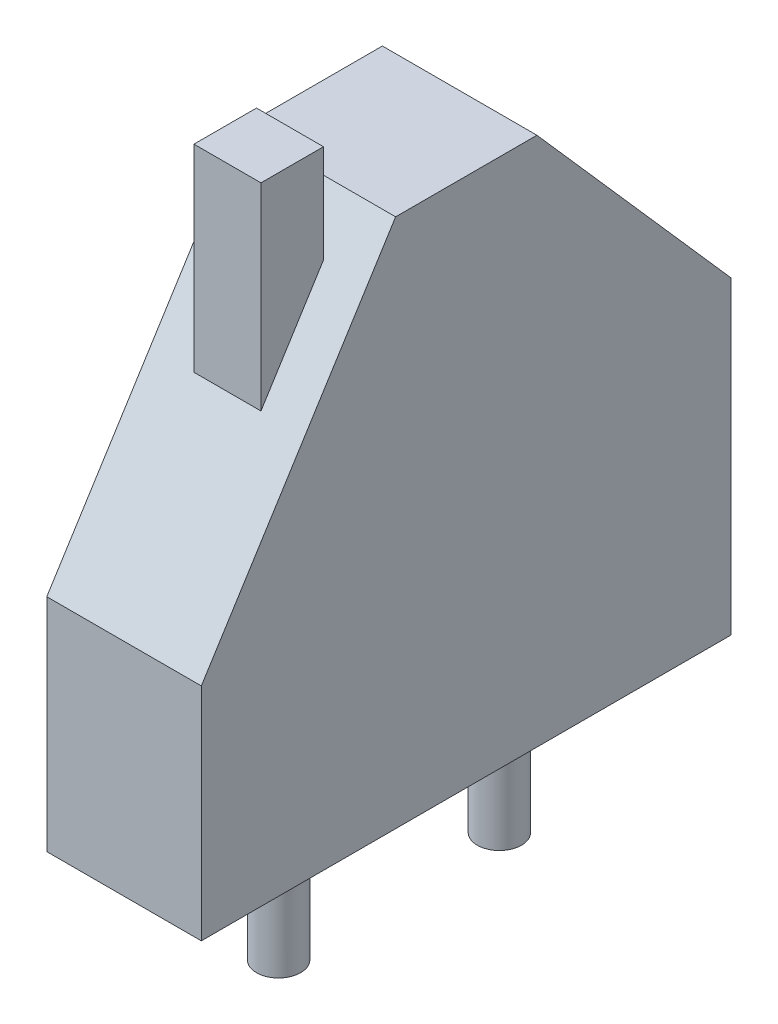
from build123d import *

# Parameters (mm, degrees)
SKETCH_1_W          = 3.5
SKETCH_1_H          = 12
EXTRUDE_1_DEPTH     = 12
SKETCH_2_R          = 0.5
EXTRUDE_2_DEPTH     = 3
CUT_EXTRUDE_1_DEPTH = 5
SKETCH_4_W          = 1.517225246
SKETCH_4_H          = 1.416076897
EXTRUDE_1_2_DEPTH   = 13.2
SKETCH_5_W          = 1.517190274
SKETCH_5_H          = 1.226412018
CUT_EXTRUDE_2_DEPTH = 2
CHAMFER_1_SIZE      = 0.5


with BuildPart() as part:
    # 草图1 → Extrude 1 (new body)
    with BuildSketch(Plane(origin=(0, 0, 0), x_dir=(1, 0, 0), z_dir=(0, 1, 0))):
        Rectangle(SKETCH_1_W, SKETCH_1_H)
    extrude(amount=EXTRUDE_1_DEPTH)

    # 草图2 → 拉伸2 (add)
    with BuildSketch(Plane.XZ):
        with Locations((0, 2.5)):
            Circle(SKETCH_2_R)
        with Locations((0, -2.5)):
            Circle(SKETCH_2_R)
    extrude(amount=EXTRUDE_2_DEPTH)

    # 草图3 → 切除-拉伸1 (cut)
    with BuildSketch(Plane(origin=(1.75, 0, 0), x_dir=(0, 0, -1), z_dir=(1, 0, 0))):
        Polygon((-1.6, 12), (-6, 5), (-6, 12), align=None)
        Polygon((1.6, 12), (6, 7), (6, 12), align=None)
    extrude(amount=-CUT_EXTRUDE_1_DEPTH, mode=Mode.SUBTRACT)

    # 草图4 → Extrude 1 2 (add)
    with BuildSketch(Plane.XZ):
        with Locations((0, 2.950160203)):
            Rectangle(SKETCH_4_W, SKETCH_4_H)
    extrude(amount=-EXTRUDE_1_2_DEPTH)

    # 草图5 → 切除-拉伸2 (cut)
    with BuildSketch(Plane(origin=(0, 0, -6), x_dir=(-1, 0, 0), z_dir=(0, 0, -1))):
        with Locations((0, 2.705799265)):
            Rectangle(SKETCH_5_W, SKETCH_5_H)
    extrude(amount=-CUT_EXTRUDE_2_DEPTH, mode=Mode.SUBTRACT)

    # 倒角1
    chamfer_1_edges = [part.edges().sort_by_distance(p)[0] for p in [
        (-0.758595137, 2.705799265, -6),
        (0, 3.319005274, -6),
        (0.758595137, 2.705799265, -6),
        (0, 2.092593256, -6),
    ]]
    chamfer(chamfer_1_edges, length=CHAMFER_1_SIZE)


solid = part.part
